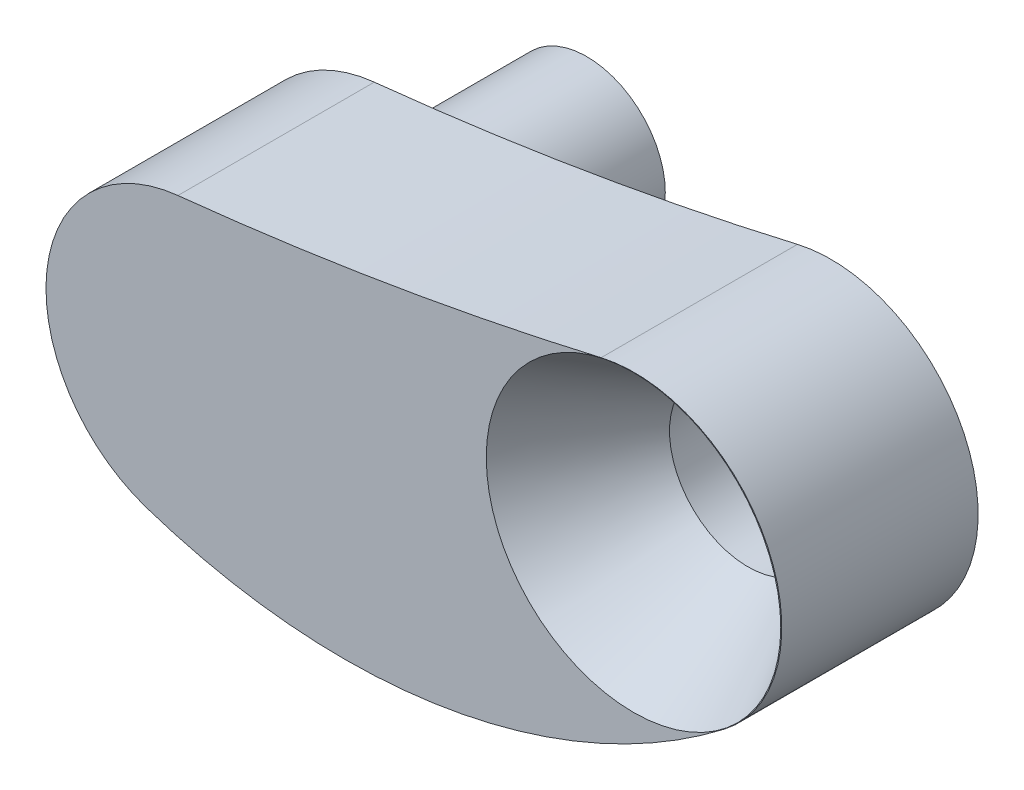
from build123d import *

# Parameters (mm, degrees)
SKETCH_1_R      = 1.6
EXTRUDE_1_DEPTH = 4
SKETCH_2_R      = 1.6
EXTRUDE_2_DEPTH = 4


with BuildPart() as part:
    # 草图1 → 凸台-拉伸1 (new body)
    with BuildSketch(Plane.XY):
        with BuildLine():
            ThreePointArc((8.309947977, -23.067013421), (4.021829561, -23.926346058), (-0.311581988, -24.516224428))
            ThreePointArc((-0.311581988, -24.516224428), (-2.982095331, -27.172727273), (-0.951286054, -30.345180986))
            ThreePointArc((-0.951286054, -30.345180986), (5.181422876, -30.824905664), (10.820251729, -28.366478575))
            ThreePointArc((10.820251729, -28.366478575), (11.70223153, -24.704408052), (8.309947977, -23.067013421))
        make_face()
        with Locations((8.969953, -25.995960132)):
            Circle(SKETCH_1_R, mode=Mode.SUBTRACT)
    extrude(amount=EXTRUDE_1_DEPTH)

    # 草图2 → 凸台-拉伸2 (add)
    with BuildSketch(Plane.XY):
        with Locations((0.01780042, -27.499994239)):
            Circle(SKETCH_2_R)
    extrude(amount=-EXTRUDE_2_DEPTH)

    # 草图3 → 切除-旋转1 (revolve, cut)
    with BuildSketch(Plane(origin=(0, -25.995960132, 0), x_dir=(1, 0, 0), z_dir=(0, 1, 0))):
        Polygon((8.969953, -4), (5.969953, -4), (7.469953, -1.5), (8.969953, -1.5), align=None)
    revolve(axis=Axis((8.969953, -25.995960132, 1.5), (0, 0, 1)), mode=Mode.SUBTRACT)


solid = part.part
